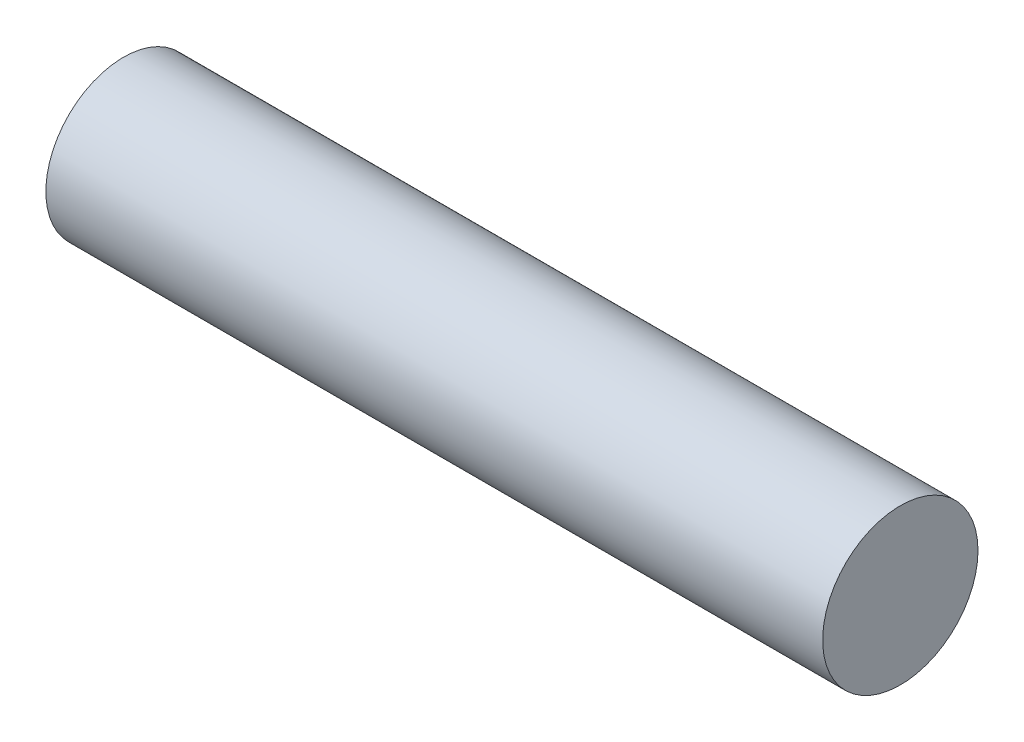
from build123d import *

# Parameters (mm, degrees)
SKETCH2_W = 381
SKETCH2_H = 38.1


with BuildPart() as part:
    # Sketch2 → Revolve1 (revolve)
    with BuildSketch(Plane(origin=(0, 0, 0), x_dir=(1, 0, 0), z_dir=(0, 1, 0))):
        with Locations((-190.5, 19.05)):
            Rectangle(SKETCH2_W, SKETCH2_H)
    revolve(axis=Axis((0, 0, 0), (-1, 0, 0)))


solid = part.part
